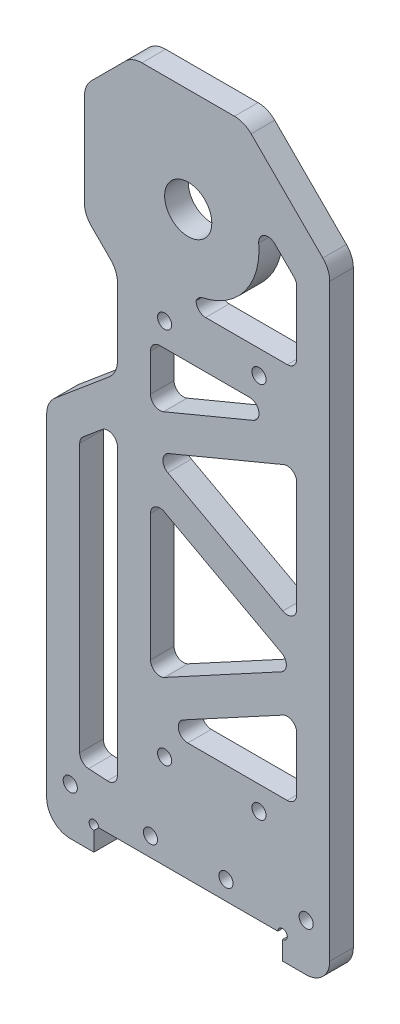
from build123d import *

# Parameters (mm, degrees)
SKETCH_1_W          = 60
SKETCH_1_H          = 150
EXTRUDE_1_DEPTH     = 5
SKETCH_2_R          = 1.5
CUT_EXTRUDE_1_DEPTH = 5
SKETCH_4_R          = 5
PITCH_DEPTH         = 154.05227865
CUT_EXTRUDE_2_DEPTH = 154.05227865
SKETCH_6_R          = 1.5
CUT_EXTRUDE_3_DEPTH = 154.05227865
CUT_EXTRUDE_4_DEPTH = 154.05227865
FILLET_1_R          = 2
FILLET_2_R          = 5


with BuildPart() as part:
    # 草图1 → 凸台-拉伸1 (new body)
    with BuildSketch(Plane.XY):
        with Locations((0, 75)):
            Rectangle(SKETCH_1_W, SKETCH_1_H)
    extrude(amount=EXTRUDE_1_DEPTH)

    # 草图2 → 切除-拉伸1 (cut)
    with BuildSketch(Plane.XY.offset(5)):
        with BuildLine():
            Line((-20, 4), (-20, 0))
            Line((-20, 0), (20, 0))
            Line((20, 0), (20, 4))
            ThreePointArc((20, 4), (20.707106781, 5.707106781), (19, 5))
            Line((19, 5), (-19, 5))
            ThreePointArc((-19, 5), (-20.707106781, 5.707106781), (-20, 4))
        make_face()
        with Locations((-25, 10)):
            Circle(SKETCH_2_R)
        with Locations((25, 10)):
            Circle(SKETCH_2_R)
        with Locations((8, 9)):
            Circle(SKETCH_2_R)
        with Locations((-8, 9)):
            Circle(SKETCH_2_R)
    extrude(amount=-CUT_EXTRUDE_1_DEPTH, mode=Mode.SUBTRACT)

    # 草图4 → pitch (cut, through all)
    with BuildSketch(Plane.XY.offset(5)):
        with Locations((0, 128)):
            Circle(SKETCH_4_R)
    extrude(amount=-PITCH_DEPTH, mode=Mode.SUBTRACT)

    # 草图5 → 切除-拉伸2 (cut, through all)
    with BuildSketch(Plane.XY.offset(5)):
        Polygon((-15, 106.983208217), (-15, 90.349685577), (-30, 77.76319111), (-30, 124.859512106), (-30, 150), (-11.874342087, 150), (-22, 139.874342087), (-22, 116.125657913), (-15, 109.125657913), align=None)
        Polygon((11.874342087, 150), (30, 131.874342087), (30, 150), align=None)
    extrude(amount=-CUT_EXTRUDE_2_DEPTH, mode=Mode.SUBTRACT)

    # 草图6 → 切除-拉伸3 (cut, through all)
    with BuildSketch(Plane(origin=(0, 0, 0), x_dir=(-1, 0, 0), z_dir=(0, 0, -1))):
        with Locations((5, 105)):
            Circle(SKETCH_6_R)
        with Locations((-15, 105)):
            Circle(SKETCH_6_R)
        with Locations((-15, 25)):
            Circle(SKETCH_6_R)
        with Locations((5, 25)):
            Circle(SKETCH_6_R)
    extrude(amount=-CUT_EXTRUDE_3_DEPTH, mode=Mode.SUBTRACT)

    # 草图7 → 切除-拉伸4 (cut, through all)
    with BuildSketch(Plane.XY.offset(5)):
        Polygon((-23, 14.89099599), (-15, 14.420407755), (-15, 81.211834552), (-23, 74.499037502), align=None)
        Polygon((-8, 37.960812568), (23, 54.751194786), (-8, 71.541577003), align=None)
        Polygon((23, 30), (23, 46.790382217), (-8, 30), align=None)
        Polygon((-8, 79.502389571), (23, 92.416857601), (23, 62.712007354), align=None)
        Polygon((-8, 87.08553197), (-8, 100), (23, 100), align=None)
        with BuildLine():
            Line((23, 126.213203436), (10.606601718, 138.606601718))
            ThreePointArc((10.606601718, 138.606601718), (13.858192988, 133.740251485), (15, 128))
            ThreePointArc((15, 128), (11.252224106, 118.080955053), (1.881672979, 113.118491111))
            Line((1.881672979, 113.118491111), (1.203740129, 110))
            Line((1.203740129, 110), (23, 110))
            Line((23, 110), (23, 126.213203436))
        make_face()
    extrude(amount=-CUT_EXTRUDE_4_DEPTH, mode=Mode.SUBTRACT)

    # 圆角1
    # the kernel refuses this fillet: 2 mm, written as the material it adds along each edge
    with BuildSketch(Plane(origin=(23, 92.416857601, 5), x_dir=(0, -1, 0), z_dir=(0, 0, -1))) as fillet_1_piece_1:
        with BuildLine():
            CenterArc((FILLET_1_R * 1.49990179984, FILLET_1_R), FILLET_1_R, 157.383597643, 112.616402357)
            Line((FILLET_1_R * 0.576801634755, FILLET_1_R * 1.38455959905), (FILLET_1_R * 0.558339631453, FILLET_1_R * 1.39225079103))
            Line((FILLET_1_R * 0.558339631453, FILLET_1_R * 1.39225079103), (-FILLET_1_R * 0.0299980359968, -FILLET_1_R * 0.02))
            Line((-FILLET_1_R * 0.0299980359968, -FILLET_1_R * 0.02), (FILLET_1_R * 1.49990179984, -FILLET_1_R * 0.02))
            Line((FILLET_1_R * 1.49990179984, -FILLET_1_R * 0.02), (FILLET_1_R * 1.49990179984, 0))
        make_face()
    extrude(amount=5)
    with BuildSketch(Plane(origin=(23, 62.712007354, 5), x_dir=(0, 1, 0), z_dir=(0, 0, -1)), Plane(origin=(-8, 71.541577003, 5), x_dir=(0, -1, 0), z_dir=(0, 0, -1)), Plane(origin=(-8, 37.960812568, 5), x_dir=(0.8793072239666883, 0.4762549799004691, 0), z_dir=(0, 0, -1))) as fillet_1_piece_2:
        with BuildLine():
            CenterArc((FILLET_1_R * 1.67888417116, -FILLET_1_R), FILLET_1_R, 90, 118.441093136)
            Line((FILLET_1_R * 0.799576947189, -FILLET_1_R * 1.4762549799), (FILLET_1_R * 0.78199080271, -FILLET_1_R * 1.4857800795))
            Line((FILLET_1_R * 0.78199080271, -FILLET_1_R * 1.4857800795), (-FILLET_1_R * 0.0335776834231, FILLET_1_R * 0.02))
            Line((-FILLET_1_R * 0.0335776834231, FILLET_1_R * 0.02), (FILLET_1_R * 1.67888417116, FILLET_1_R * 0.02))
            Line((FILLET_1_R * 1.67888417116, FILLET_1_R * 0.02), (FILLET_1_R * 1.67888417116, 0))
        make_face()
    extrude(amount=5)
    with BuildSketch(Plane(origin=(-8, 79.502389571, 5), x_dir=(0.8793072239666883, -0.4762549799004693, 0), z_dir=(0, 0, -1))) as fillet_1_piece_3:
        with BuildLine():
            CenterArc((FILLET_1_R * 2.09383929261, -FILLET_1_R), FILLET_1_R, 90, 128.942504507)
            Line((FILLET_1_R * 1.31606220856, -FILLET_1_R * 1.62854021949), (FILLET_1_R * 1.30050666688, -FILLET_1_R * 1.64111102388))
            Line((FILLET_1_R * 1.30050666688, -FILLET_1_R * 1.64111102388), (-FILLET_1_R * 0.0155555416811, -FILLET_1_R * 0.0125708043898))
            Line((-FILLET_1_R * 0.0155555416811, -FILLET_1_R * 0.0125708043898), (0, FILLET_1_R * 0.02))
            Line((0, FILLET_1_R * 0.02), (FILLET_1_R * 2.09383929261, FILLET_1_R * 0.02))
            Line((FILLET_1_R * 2.09383929261, FILLET_1_R * 0.02), (FILLET_1_R * 2.09383929261, 0))
        make_face()
    extrude(amount=5)
    with BuildSketch(Plane(origin=(23, 126.213203436, 5), x_dir=(-0.7071067811865497, 0.7071067811865455, 0), z_dir=(0, 0, -1))) as fillet_1_piece_4:
        with BuildLine():
            CenterArc((FILLET_1_R * 0.414213562373, -FILLET_1_R), FILLET_1_R, 90, 45)
            Line((-FILLET_1_R * 0.292893218813, -FILLET_1_R * 0.292893218813), (-FILLET_1_R * 0.307035354437, -FILLET_1_R * 0.27875108319))
            Line((-FILLET_1_R * 0.307035354437, -FILLET_1_R * 0.27875108319), (-FILLET_1_R * 0.00828427124746, FILLET_1_R * 0.02))
            Line((-FILLET_1_R * 0.00828427124746, FILLET_1_R * 0.02), (FILLET_1_R * 0.414213562373, FILLET_1_R * 0.02))
            Line((FILLET_1_R * 0.414213562373, FILLET_1_R * 0.02), (FILLET_1_R * 0.414213562373, 0))
        make_face()
    extrude(amount=5)
    with BuildSketch(Plane(origin=(23, 110, 5), x_dir=(0, 1, 0), z_dir=(0, 0, -1)), Plane(origin=(23, 30, 5), x_dir=(0, 1, 0), z_dir=(0, 0, -1))) as fillet_1_piece_5:
        with BuildLine():
            CenterArc((FILLET_1_R, -FILLET_1_R), FILLET_1_R, 90, 90)
            Line((0, -FILLET_1_R), (-FILLET_1_R * 0.02, -FILLET_1_R))
            Line((-FILLET_1_R * 0.02, -FILLET_1_R), (-FILLET_1_R * 0.02, FILLET_1_R * 0.02))
            Line((-FILLET_1_R * 0.02, FILLET_1_R * 0.02), (FILLET_1_R, FILLET_1_R * 0.02))
            Line((FILLET_1_R, FILLET_1_R * 0.02), (FILLET_1_R, 0))
        make_face()
    extrude(amount=5)
    with BuildSketch(Plane(origin=(1.203740129, 110, 5), x_dir=(1, 0, 0), z_dir=(0, 0, -1))) as fillet_1_piece_6:
        with BuildLine():
            CenterArc((FILLET_1_R * 1.24074802573, -FILLET_1_R), FILLET_1_R, 90, 102.264773728)
            Line((FILLET_1_R * 0.263571661811, -FILLET_1_R * 1.21242964433), (FILLET_1_R * 0.244028134533, -FILLET_1_R * 1.21667823722))
            Line((FILLET_1_R * 0.244028134533, -FILLET_1_R * 1.21667823722), (-FILLET_1_R * 0.0248149605147, FILLET_1_R * 0.02))
            Line((-FILLET_1_R * 0.0248149605147, FILLET_1_R * 0.02), (FILLET_1_R * 1.24074802573, FILLET_1_R * 0.02))
            Line((FILLET_1_R * 1.24074802573, FILLET_1_R * 0.02), (FILLET_1_R * 1.24074802573, 0))
        make_face()
    extrude(amount=5)
    with BuildSketch(Plane(origin=(1.881672979, 113.118491111, 5), x_dir=(-0.2124296443310413, -0.9771763639228015, 0), z_dir=(0, 0, -1))) as fillet_1_piece_7:
        with BuildLine():
            CenterArc((1.349797761, -2), FILLET_1_R, 90, 65.684260829)
            Line((-0.472782637, -1.176470588), (-0.509234245, -1.16))
            ThreePointArc((-0.509234245, -1.16), (-0.261070379, -0.578317638), (-0.037712362, 0.013333333))
            Line((-0.037712362, 0.013333333), (0, 0.04))
            Line((0, 0.04), (1.349797761, 0.04))
            Line((1.349797761, 0.04), (1.349797761, 0))
        make_face()
    extrude(amount=5)
    with BuildSketch(Plane(origin=(-8, 30, 5), x_dir=(1, 0, 0), z_dir=(0, 0, -1))) as fillet_1_piece_8:
        with BuildLine():
            CenterArc((FILLET_1_R * 3.94601065244, -FILLET_1_R), FILLET_1_R, 90, 151.558906864)
            Line((FILLET_1_R * 3.46975567254, -FILLET_1_R * 1.87930722397), (FILLET_1_R * 3.46023057295, -FILLET_1_R * 1.89689336845))
            Line((FILLET_1_R * 3.46023057295, -FILLET_1_R * 1.89689336845), (-FILLET_1_R * 0.00952509959801, -FILLET_1_R * 0.0175861444793))
            Line((-FILLET_1_R * 0.00952509959801, -FILLET_1_R * 0.0175861444793), (0, FILLET_1_R * 0.02))
            Line((0, FILLET_1_R * 0.02), (FILLET_1_R * 3.94601065244, FILLET_1_R * 0.02))
            Line((FILLET_1_R * 3.94601065244, FILLET_1_R * 0.02), (FILLET_1_R * 3.94601065244, 0))
        make_face()
    extrude(amount=5)
    with BuildSketch(Plane(origin=(23, 46.790382217, 5), x_dir=(0, -1, 0), z_dir=(0, 0, -1))) as fillet_1_piece_9:
        with BuildLine():
            CenterArc((FILLET_1_R * 1.67888417116, FILLET_1_R), FILLET_1_R, 151.558906864, 118.441093136)
            Line((FILLET_1_R * 0.799576947189, FILLET_1_R * 1.4762549799), (FILLET_1_R * 0.78199080271, FILLET_1_R * 1.4857800795))
            Line((FILLET_1_R * 0.78199080271, FILLET_1_R * 1.4857800795), (-FILLET_1_R * 0.0335776834231, -FILLET_1_R * 0.02))
            Line((-FILLET_1_R * 0.0335776834231, -FILLET_1_R * 0.02), (FILLET_1_R * 1.67888417116, -FILLET_1_R * 0.02))
            Line((FILLET_1_R * 1.67888417116, -FILLET_1_R * 0.02), (FILLET_1_R * 1.67888417116, 0))
        make_face()
    extrude(amount=5)
    with BuildSketch(Plane(origin=(23, 54.751194786, 5), x_dir=(-0.8793072239666878, -0.47625497990046983, 0), z_dir=(0, 0, -1))) as fillet_1_piece_10:
        with BuildLine():
            CenterArc((FILLET_1_R * 1.84629507528, FILLET_1_R), FILLET_1_R, 146.882186272, 123.117813728)
            Line((FILLET_1_R * 1.00874618672, FILLET_1_R * 1.54636238824), (FILLET_1_R * 0.991995208953, FILLET_1_R * 1.557289636))
            Line((FILLET_1_R * 0.991995208953, FILLET_1_R * 1.557289636), (-FILLET_1_R * 0.0167509777711, FILLET_1_R * 0.0109272477648))
            Line((-FILLET_1_R * 0.0167509777711, FILLET_1_R * 0.0109272477648), (0, -FILLET_1_R * 0.02))
            Line((0, -FILLET_1_R * 0.02), (FILLET_1_R * 1.84629507528, -FILLET_1_R * 0.02))
            Line((FILLET_1_R * 1.84629507528, -FILLET_1_R * 0.02), (FILLET_1_R * 1.84629507528, 0))
        make_face()
    extrude(amount=5)
    with BuildSketch(Plane(origin=(-8, 100, 5), x_dir=(1, 0, 0), z_dir=(0, 0, -1))) as fillet_1_piece_11:
        with BuildLine():
            CenterArc((FILLET_1_R, FILLET_1_R), FILLET_1_R, 180, 90)
            Line((0, FILLET_1_R), (-FILLET_1_R * 0.02, FILLET_1_R))
            Line((-FILLET_1_R * 0.02, FILLET_1_R), (-FILLET_1_R * 0.02, -FILLET_1_R * 0.02))
            Line((-FILLET_1_R * 0.02, -FILLET_1_R * 0.02), (FILLET_1_R, -FILLET_1_R * 0.02))
            Line((FILLET_1_R, -FILLET_1_R * 0.02), (FILLET_1_R, 0))
        make_face()
    extrude(amount=5)
    with BuildSketch(Plane(origin=(23, 100, 5), x_dir=(-1, 0, 0), z_dir=(0, 0, -1))) as fillet_1_piece_12:
        with BuildLine():
            CenterArc((FILLET_1_R * 5.0007857556, -FILLET_1_R), FILLET_1_R, 90, 157.383597643)
            Line((FILLET_1_R * 4.61622615655, -FILLET_1_R * 1.92310016509), (FILLET_1_R * 4.60853496457, -FILLET_1_R * 1.94156216839))
            Line((FILLET_1_R * 4.60853496457, -FILLET_1_R * 1.94156216839), (-FILLET_1_R * 0.00769119198092, -FILLET_1_R * 0.0184620033017))
            Line((-FILLET_1_R * 0.00769119198092, -FILLET_1_R * 0.0184620033017), (0, FILLET_1_R * 0.02))
            Line((0, FILLET_1_R * 0.02), (FILLET_1_R * 5.0007857556, FILLET_1_R * 0.02))
            Line((FILLET_1_R * 5.0007857556, FILLET_1_R * 0.02), (FILLET_1_R * 5.0007857556, 0))
        make_face()
    extrude(amount=5)
    with BuildSketch(Plane(origin=(-8, 87.08553197, 5), x_dir=(0.923100165085959, 0.38455959904581105, 0), z_dir=(0, 0, -1))) as fillet_1_piece_13:
        with BuildLine():
            CenterArc((FILLET_1_R * 1.49990179984, -FILLET_1_R), FILLET_1_R, 90, 112.616402357)
            Line((FILLET_1_R * 0.576801634755, -FILLET_1_R * 1.38455959905), (FILLET_1_R * 0.558339631453, -FILLET_1_R * 1.39225079103))
            Line((FILLET_1_R * 0.558339631453, -FILLET_1_R * 1.39225079103), (-FILLET_1_R * 0.0299980359968, FILLET_1_R * 0.02))
            Line((-FILLET_1_R * 0.0299980359968, FILLET_1_R * 0.02), (FILLET_1_R * 1.49990179984, FILLET_1_R * 0.02))
            Line((FILLET_1_R * 1.49990179984, FILLET_1_R * 0.02), (FILLET_1_R * 1.49990179984, 0))
        make_face()
    extrude(amount=5)
    with BuildSketch(Plane(origin=(-15, 81.211834552, 5), x_dir=(-0.7660444431189756, -0.6427876096865422, 0), z_dir=(0, 0, -1))) as fillet_1_piece_14:
        with BuildLine():
            CenterArc((FILLET_1_R * 2.14450692051, -FILLET_1_R), FILLET_1_R, 90, 130)
            Line((FILLET_1_R * 1.37846247739, -FILLET_1_R * 1.64278760969), (FILLET_1_R * 1.36314158853, -FILLET_1_R * 1.65564336188))
            Line((FILLET_1_R * 1.36314158853, -FILLET_1_R * 1.65564336188), (-FILLET_1_R * 0.0153208888624, -FILLET_1_R * 0.0128557521937))
            Line((-FILLET_1_R * 0.0153208888624, -FILLET_1_R * 0.0128557521937), (0, FILLET_1_R * 0.02))
            Line((0, FILLET_1_R * 0.02), (FILLET_1_R * 2.14450692051, FILLET_1_R * 0.02))
            Line((FILLET_1_R * 2.14450692051, FILLET_1_R * 0.02), (FILLET_1_R * 2.14450692051, 0))
        make_face()
    extrude(amount=5)
    with BuildSketch(Plane(origin=(-15, 14.420407755, 5), x_dir=(-0.9982743731749961, 0.05872202195146987, 0), z_dir=(0, 0, -1))) as fillet_1_piece_15:
        with BuildLine():
            CenterArc((FILLET_1_R * 1.06055213917, FILLET_1_R), FILLET_1_R, 176.633539337, 93.366460663)
            Line((FILLET_1_R * 0.0622777659971, FILLET_1_R * 1.05872202195), (FILLET_1_R * 0.0423122785336, FILLET_1_R * 1.05989646239))
            Line((FILLET_1_R * 0.0423122785336, FILLET_1_R * 1.05989646239), (-FILLET_1_R * 0.0212110427834, -FILLET_1_R * 0.02))
            Line((-FILLET_1_R * 0.0212110427834, -FILLET_1_R * 0.02), (FILLET_1_R * 1.06055213917, -FILLET_1_R * 0.02))
            Line((FILLET_1_R * 1.06055213917, -FILLET_1_R * 0.02), (FILLET_1_R * 1.06055213917, 0))
        make_face()
    extrude(amount=5)
    with BuildSketch(Plane(origin=(-23, 14.89099599, 5), x_dir=(0.998274373174996, -0.05872202195146952, 0), z_dir=(0, 0, -1))) as fillet_1_piece_16:
        with BuildLine():
            CenterArc((FILLET_1_R * 0.942905080349, -FILLET_1_R), FILLET_1_R, 90, 86.633539337)
            Line((-FILLET_1_R * 0.0553692928264, -FILLET_1_R * 0.941277978049), (-FILLET_1_R * 0.0753347802899, -FILLET_1_R * 0.94010353761))
            Line((-FILLET_1_R * 0.0753347802899, -FILLET_1_R * 0.94010353761), (-FILLET_1_R * 0.018858101607, FILLET_1_R * 0.02))
            Line((-FILLET_1_R * 0.018858101607, FILLET_1_R * 0.02), (FILLET_1_R * 0.942905080349, FILLET_1_R * 0.02))
            Line((FILLET_1_R * 0.942905080349, FILLET_1_R * 0.02), (FILLET_1_R * 0.942905080349, 0))
        make_face()
    extrude(amount=5)
    with BuildSketch(Plane(origin=(-23, 74.499037502, 5), x_dir=(0, -1, 0), z_dir=(0, 0, -1))) as fillet_1_piece_17:
        with BuildLine():
            CenterArc((FILLET_1_R * 0.466307658155, -FILLET_1_R), FILLET_1_R, 90, 50)
            Line((-FILLET_1_R * 0.299736784964, -FILLET_1_R * 0.357212390313), (-FILLET_1_R * 0.315057673826, -FILLET_1_R * 0.34435663812))
            Line((-FILLET_1_R * 0.315057673826, -FILLET_1_R * 0.34435663812), (-FILLET_1_R * 0.0093261531631, FILLET_1_R * 0.02))
            Line((-FILLET_1_R * 0.0093261531631, FILLET_1_R * 0.02), (FILLET_1_R * 0.466307658155, FILLET_1_R * 0.02))
            Line((FILLET_1_R * 0.466307658155, FILLET_1_R * 0.02), (FILLET_1_R * 0.466307658155, 0))
        make_face()
    extrude(amount=5)
    fillet_1_2_edges = [part.edges().sort_by_distance(p)[0] for p in [
        (10.606601718, 138.606601718, 2.5),
    ]]
    fillet(fillet_1_2_edges, radius=FILLET_1_R)

    # 圆角2
    fillet_2_edges = [part.edges().sort_by_distance(p)[0] for p in [
        (-11.874342087, 150, 2.5),
        (-22, 139.874342087, 2.5),
        (-22, 116.125657913, 2.5),
        (-15, 109.125657913, 2.5),
        (-15, 90.349685577, 2.5),
        (-30, 77.76319111, 2.5),
        (30, 0, 2.5),
        (-30, 0, 2.5),
        (11.874342087, 150, 2.5),
        (30, 131.874342087, 2.5),
    ]]
    fillet(fillet_2_edges, radius=FILLET_2_R)


solid = part.part
